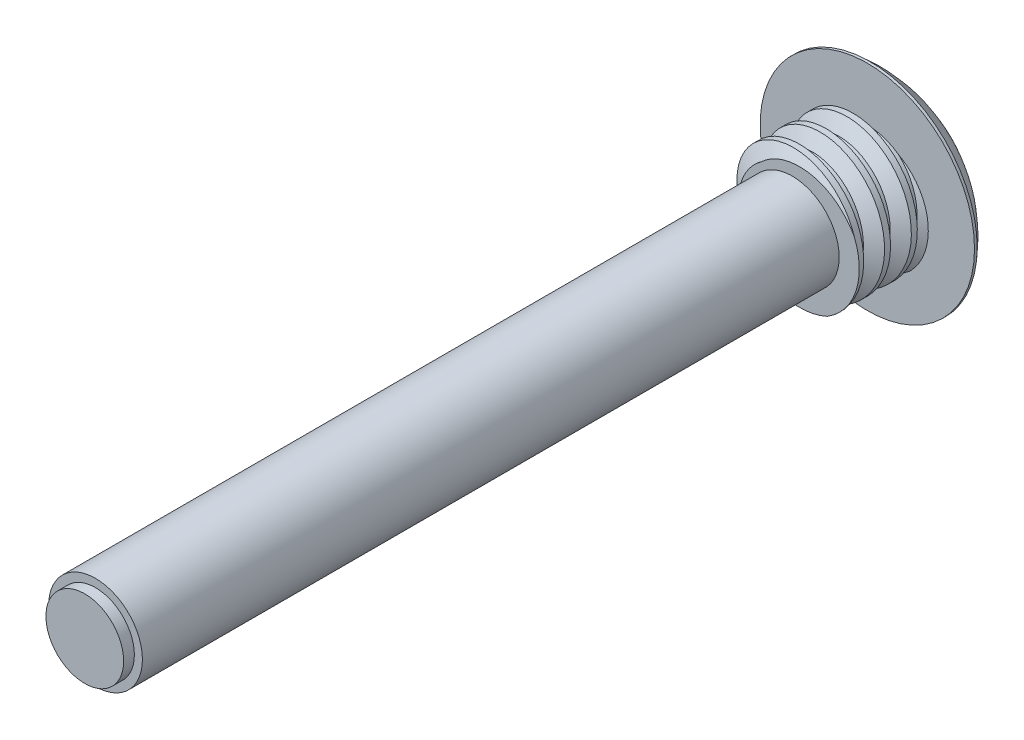
from build123d import *

# Parameters (mm, degrees)
SKETCH3_R           = 3.175
BOSS_EXTRUDE1_DEPTH = 3.556
CUT_SWEEP1_PITCH    = 1.27
SKETCH10_R          = 2.2225
BOSS_EXTRUDE5_DEPTH = 33.02
SKETCH9_R           = 5.08
BOSS_EXTRUDE4_DEPTH = 0.127
DOME3_FACE_RADIUS   = 5.08
DOME3_HEIGHT        = 2.38
SKETCH11_R          = 1.8415
BOSS_EXTRUDE6_DEPTH = 0.508


with BuildPart() as part:
    # Sketch3 → Boss-Extrude1 (new body)
    with BuildSketch(Plane.XY):
        Circle(SKETCH3_R)
    extrude(amount=BOSS_EXTRUDE1_DEPTH)

    # Cut-Sweep1: arcs per turn and ends read off the stored shape
    # Cut-Sweep1: the profile of Sketch5 profile screwed along a left-hand helix through 5 turns, 8 arcs to a turn; built about Z, then put on its axis
    cut_sweep1_z = Axis((0, 0, 0), (0, 0, 1))
    cut_sweep1_corners = [(2.54, 0, -1.397), (3.1753, 0, -1.763790626), (3.1753, 0, -0.776209374), (2.54, 0, -1.143)]
    with BuildLine(mode=Mode.PRIVATE) as cut_sweep1_profile:
        Line(cut_sweep1_corners[0], cut_sweep1_corners[1])
        Line(cut_sweep1_corners[1], cut_sweep1_corners[2])
        Line(cut_sweep1_corners[2], cut_sweep1_corners[3])
        Line(cut_sweep1_corners[3], cut_sweep1_corners[0])
    cut_sweep1_cap = Face(cut_sweep1_profile.wire())
    cut_sweep1_turn_angles = [0, -22.5, -45, -67.5, -90, -112.5, -135, -157.5, -180, -202.5, -225, -247.5, -270, -292.5, -315, -337.5, -360]
    cut_sweep1_turn_weights = [1, 0.9238795325112867, 1, 0.9238795325112867, 1, 0.9238795325112867, 1, 0.9238795325112867, 1, 0.9238795325112867, 1, 0.9238795325112867, 1, 0.9238795325112867, 1, 0.9238795325112867, 1]
    cut_sweep1_turn_rails = [Edge.make_bspline([Vector(p[0], p[1], 0).rotate(cut_sweep1_z, cut_sweep1_turn_angles[k]) / cut_sweep1_turn_weights[k] + Vector(0, 0, p[2] + -CUT_SWEEP1_PITCH * cut_sweep1_turn_angles[k] / 360) for k in range(17)], [0, 0, 0, 1, 1, 2, 2, 3, 3, 4, 4, 5, 5, 6, 6, 7, 7, 8, 8, 8], 2, cut_sweep1_turn_weights) for p in cut_sweep1_corners]
    cut_sweep1_turn_sides = [Face.make_surface_from_curves(cut_sweep1_turn_rails[p[0]], cut_sweep1_turn_rails[p[1]]) for p in [(0, 1), (1, 2), (2, 3), (3, 0)]]
    cut_sweep1 = Plane(origin=(0, 0, 0), x_dir=(0, 1, 0), z_dir=(0, 0, 1)) * Solid(Shell([*[p.moved(Location((0, 0, CUT_SWEEP1_PITCH * i))) for i in range(5) for p in cut_sweep1_turn_sides], cut_sweep1_cap, cut_sweep1_cap.rotate(cut_sweep1_z, -1800).moved(Location((0, 0, -CUT_SWEEP1_PITCH * -1800 / 360)))]))
    add(cut_sweep1, mode=Mode.SUBTRACT)

    # Sketch10 → Boss-Extrude5 (add)
    with BuildSketch(Plane.XY.offset(3.556)):
        Circle(SKETCH10_R)
    extrude(amount=BOSS_EXTRUDE5_DEPTH)

    # Sketch9 → Boss-Extrude4 (add)
    with BuildSketch(Plane.XY):
        Circle(SKETCH9_R)
    extrude(amount=-BOSS_EXTRUDE4_DEPTH)

    # Dome3: a dome of height H over a round flat face of radius A is a cap of a sphere of radius (A * A + H * H) / (2 * H)
    dome3_r = (DOME3_FACE_RADIUS * DOME3_FACE_RADIUS + DOME3_HEIGHT * DOME3_HEIGHT) / (2 * DOME3_HEIGHT)
    dome3_base = Plane((0, 0, -0.127), z_dir=(0, 0, -1))
    with Locations(dome3_base.offset(DOME3_HEIGHT - dome3_r)):
        dome3_ball = Sphere(dome3_r, mode=Mode.PRIVATE)
    add(split(dome3_ball, bisect_by=dome3_base, keep=Keep.TOP, mode=Mode.PRIVATE))

    # Sketch11 → Boss-Extrude6 (add)
    with BuildSketch(Plane.XY.offset(36.576)):
        Circle(SKETCH11_R)
    extrude(amount=BOSS_EXTRUDE6_DEPTH)


solid = part.part
